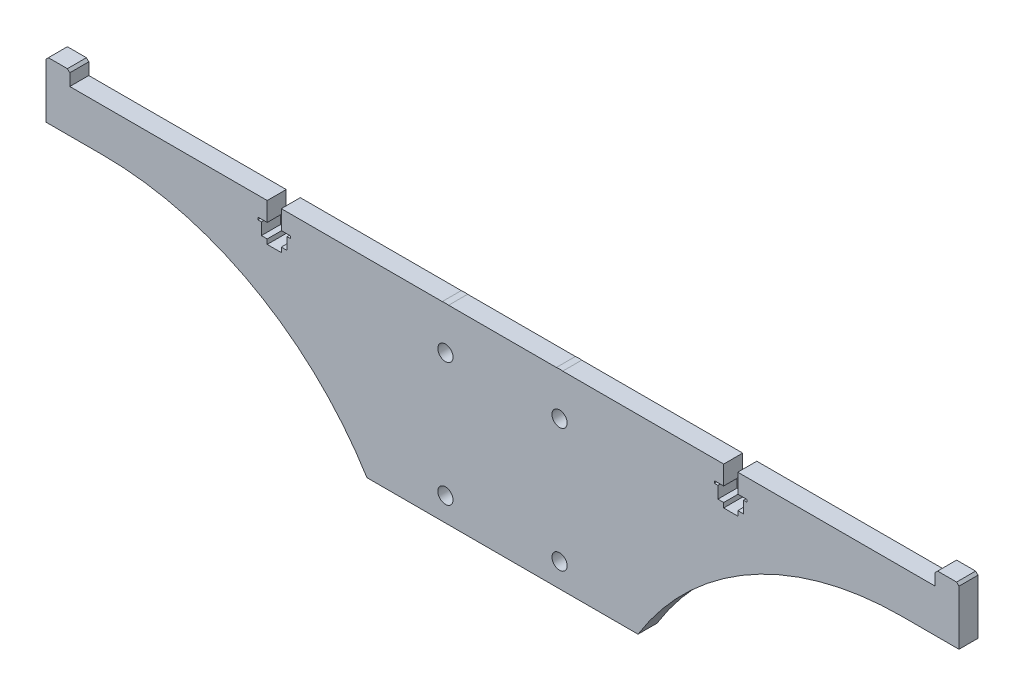
from build123d import *

# Parameters (mm, degrees)
BOSS_EXTRUDE1_DEPTH = 4
SKETCH2_R           = 1.6
CUT_EXTRUDE1_DEPTH  = 100.282425434
CHAMFER1_SIZE       = 0.5
CUT_EXTRUDE2_DEPTH  = 100.282425434


with BuildPart() as part:
    # Sketch1 → Boss-Extrude1 (new body)
    with BuildSketch(Plane.XY):
        with BuildLine():
            Line((0, 22), (-11.330272149, 22))
            ThreePointArc((-11.330272149, 22), (-12, 22.050116338), (-12.669727851, 22))
            Line((-12.669727851, 22), (-91, 22))
            Line((-91, 22), (-91, 25))
            Line((-91, 25), (-96, 25))
            Line((-96, 25), (-96, 13))
            Line((-96, 13), (-84, 13))
            ThreePointArc((-84, 13), (-52.214586679, 4.724691591), (-28.5, -18))
            Line((-28.5, -18), (0, -18))
            Line((0, -18), (28.5, -18))
            ThreePointArc((28.5, -18), (52.214586679, 4.724691591), (84, 13))
            Line((84, 13), (96, 13))
            Line((96, 13), (96, 25))
            Line((96, 25), (91, 25))
            Line((91, 25), (91, 22))
            Line((91, 22), (12.669727851, 22))
            ThreePointArc((12.669727851, 22), (12, 22.050116338), (11.330272149, 22))
            Line((11.330272149, 22), (0, 22))
        make_face()
    extrude(amount=BOSS_EXTRUDE1_DEPTH)

    # Sketch2 → Cut-Extrude1 (cut, through all)
    with BuildSketch(Plane.XY.offset(4)):
        with Locations((12, -13)):
            Circle(SKETCH2_R)
        with Locations((12, 13)):
            Circle(SKETCH2_R)
    cut_extrude1 = extrude(amount=-CUT_EXTRUDE1_DEPTH, mode=Mode.SUBTRACT)

    # Mirror1: Cut-Extrude1 across plane
    add(cut_extrude1.mirror(Plane(origin=(0, 0, 0), x_dir=(0, 0, 1), z_dir=(1, 0, 0))), mode=Mode.SUBTRACT)

    # Chamfer1
    chamfer1_edges = [part.edges().sort_by_distance(p)[0] for p in [
        (96, 25, 2),
        (91, 25, 2),
        (-91, 25, 2),
        (-96, 25, 2),
    ]]
    chamfer(chamfer1_edges, length=CHAMFER1_SIZE)

    # Sketch4 → Cut-Extrude2 (cut, through all)
    with BuildSketch(Plane.XY.offset(4)):
        Polygon((-49.48, 22), (-49.48, 18), (-51.45, 18), (-51.45, 17.5), (-50.7, 17.5), (-50.7, 15), (-49.48, 15), (-49.48, 14), (-46.52, 14), (-46.52, 15), (-45.3, 15), (-45.3, 17.5), (-44.55, 17.5), (-44.55, 18), (-46.52, 18), (-46.52, 22), align=None)
        Polygon((46.52, 22), (46.52, 18), (44.55, 18), (44.55, 17.5), (45.3, 17.5), (45.3, 15), (46.52, 15), (46.52, 14), (49.48, 14), (49.48, 15), (50.7, 15), (50.7, 17.5), (51.45, 17.5), (51.45, 18), (49.48, 18), (49.48, 22), align=None)
    extrude(amount=-CUT_EXTRUDE2_DEPTH, mode=Mode.SUBTRACT)


solid = part.part
